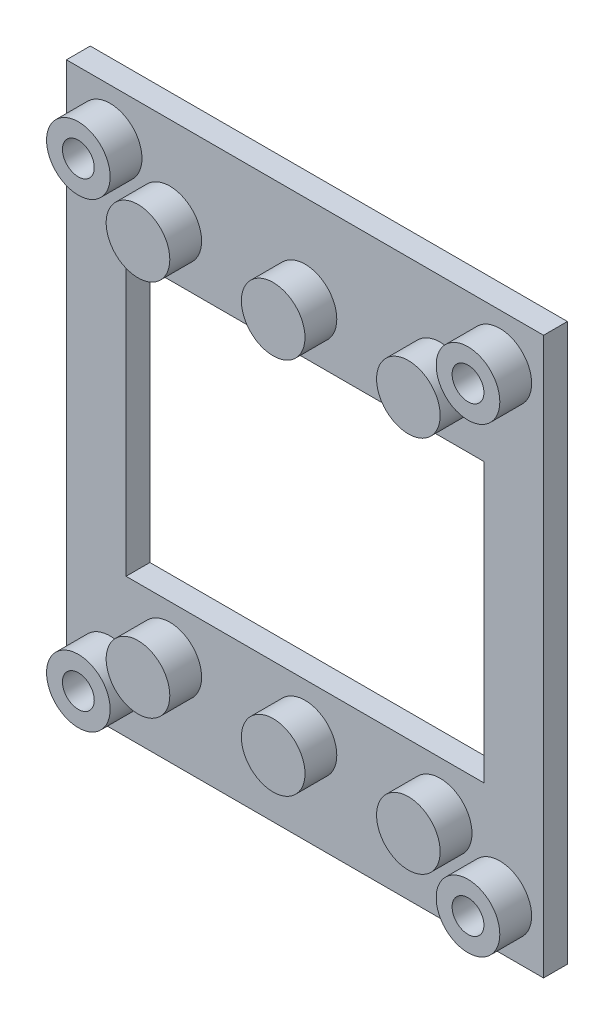
from build123d import *

# Parameters (mm, degrees)
ESQUISSE1_W               = 60
ESQUISSE1_H               = 70
T_LE_DE_BASE_PLI_E1_DEPTH = 3
ENL_V_MAT_EXTRU_1_REACH   = 48.195
ESQUISSE6_R               = 2
ENL_V_MAT_EXTRU_2_REACH   = 48.195
ESQUISSE7_R               = 2
BOSS_EXTRU_1_START        = 4
ESQUISSE9_R               = 4
ESQUISSE9_R_2             = 2
BOSS_EXTRU_1_DEPTH        = 4
ENL_V_MAT_EXTRU_3_REACH   = 48.271
ESQUISSE10_W              = 45
ESQUISSE10_H              = 35
BOSS_EXTRU_2_START        = -1
ESQUISSE11_R              = 2
BOSS_EXTRU_2_DEPTH        = 1
BOSS_EXTRU_3_START        = 3
ESQUISSE12_R              = 4
ESQUISSE12_R_2            = 2
BOSS_EXTRU_3_DEPTH        = 3
BOSS_EXTRU_4_START        = 1
ESQUISSE13_R              = 4
BOSS_EXTRU_4_DEPTH        = 1


# Sheet-metal steps are written as plain solids
with BuildPart() as part:
    # Esquisse1 → Tôle de base pliée1 (new body)
    with BuildSketch(Plane.XY):
        Rectangle(ESQUISSE1_W, ESQUISSE1_H)
    extrude(amount=-T_LE_DE_BASE_PLI_E1_DEPTH)

    # Esquisse6 → Enlèv. mat.-Extru.1 (cut, up to next)
    with BuildSketch(Plane.XY, mode=Mode.PRIVATE) as enl_v_mat_extru_1_sk1:
        with Locations((-24.5, 29)):
            Circle(ESQUISSE6_R)
    enl_v_mat_extru_1_tool1 = extrude(enl_v_mat_extru_1_sk1.sketch, amount=-ENL_V_MAT_EXTRU_1_REACH, mode=Mode.PRIVATE) & part.part
    # Esquisse6 → Enlèv. mat.-Extru.1 (cut, up to next)
    with BuildSketch(Plane.XY, mode=Mode.PRIVATE) as enl_v_mat_extru_1_sk2:
        with Locations((24.5, 29)):
            Circle(ESQUISSE6_R)
    enl_v_mat_extru_1_tool2 = extrude(enl_v_mat_extru_1_sk2.sketch, amount=-ENL_V_MAT_EXTRU_1_REACH, mode=Mode.PRIVATE) & part.part
    # Esquisse6 → Enlèv. mat.-Extru.1 (cut, up to next)
    with BuildSketch(Plane.XY, mode=Mode.PRIVATE) as enl_v_mat_extru_1_sk3:
        with Locations((24.5, -29)):
            Circle(ESQUISSE6_R)
    enl_v_mat_extru_1_tool3 = extrude(enl_v_mat_extru_1_sk3.sketch, amount=-ENL_V_MAT_EXTRU_1_REACH, mode=Mode.PRIVATE) & part.part
    # Esquisse6 → Enlèv. mat.-Extru.1 (cut, up to next)
    with BuildSketch(Plane.XY, mode=Mode.PRIVATE) as enl_v_mat_extru_1_sk4:
        with Locations((-24.5, -29)):
            Circle(ESQUISSE6_R)
    enl_v_mat_extru_1_tool4 = extrude(enl_v_mat_extru_1_sk4.sketch, amount=-ENL_V_MAT_EXTRU_1_REACH, mode=Mode.PRIVATE) & part.part
    add(enl_v_mat_extru_1_tool1.solids().sort_by_distance((-24.5, 29, 0))[0], mode=Mode.SUBTRACT)
    add(enl_v_mat_extru_1_tool2.solids().sort_by_distance((24.5, 29, 0))[0], mode=Mode.SUBTRACT)
    add(enl_v_mat_extru_1_tool3.solids().sort_by_distance((24.5, -29, 0))[0], mode=Mode.SUBTRACT)
    add(enl_v_mat_extru_1_tool4.solids().sort_by_distance((-24.5, -29, 0))[0], mode=Mode.SUBTRACT)

    # Esquisse7 → Enlèv. mat.-Extru.2 (cut, up to next)
    with BuildSketch(Plane.XY, mode=Mode.PRIVATE) as enl_v_mat_extru_2_sk1:
        with Locations((-17, -23.75)):
            Circle(ESQUISSE7_R)
    enl_v_mat_extru_2_tool1 = extrude(enl_v_mat_extru_2_sk1.sketch, amount=-ENL_V_MAT_EXTRU_2_REACH, mode=Mode.PRIVATE) & part.part
    # Esquisse7 → Enlèv. mat.-Extru.2 (cut, up to next)
    with BuildSketch(Plane.XY, mode=Mode.PRIVATE) as enl_v_mat_extru_2_sk2:
        with Locations((0, -23.75)):
            Circle(ESQUISSE7_R)
    enl_v_mat_extru_2_tool2 = extrude(enl_v_mat_extru_2_sk2.sketch, amount=-ENL_V_MAT_EXTRU_2_REACH, mode=Mode.PRIVATE) & part.part
    # Esquisse7 → Enlèv. mat.-Extru.2 (cut, up to next)
    with BuildSketch(Plane.XY, mode=Mode.PRIVATE) as enl_v_mat_extru_2_sk3:
        with Locations((17, -23.75)):
            Circle(ESQUISSE7_R)
    enl_v_mat_extru_2_tool3 = extrude(enl_v_mat_extru_2_sk3.sketch, amount=-ENL_V_MAT_EXTRU_2_REACH, mode=Mode.PRIVATE) & part.part
    # Esquisse7 → Enlèv. mat.-Extru.2 (cut, up to next)
    with BuildSketch(Plane.XY, mode=Mode.PRIVATE) as enl_v_mat_extru_2_sk4:
        with Locations((0, 23.75)):
            Circle(ESQUISSE7_R)
    enl_v_mat_extru_2_tool4 = extrude(enl_v_mat_extru_2_sk4.sketch, amount=-ENL_V_MAT_EXTRU_2_REACH, mode=Mode.PRIVATE) & part.part
    # Esquisse7 → Enlèv. mat.-Extru.2 (cut, up to next)
    with BuildSketch(Plane.XY, mode=Mode.PRIVATE) as enl_v_mat_extru_2_sk5:
        with Locations((17, 23.75)):
            Circle(ESQUISSE7_R)
    enl_v_mat_extru_2_tool5 = extrude(enl_v_mat_extru_2_sk5.sketch, amount=-ENL_V_MAT_EXTRU_2_REACH, mode=Mode.PRIVATE) & part.part
    # Esquisse7 → Enlèv. mat.-Extru.2 (cut, up to next)
    with BuildSketch(Plane.XY, mode=Mode.PRIVATE) as enl_v_mat_extru_2_sk6:
        with Locations((-17, 23.75)):
            Circle(ESQUISSE7_R)
    enl_v_mat_extru_2_tool6 = extrude(enl_v_mat_extru_2_sk6.sketch, amount=-ENL_V_MAT_EXTRU_2_REACH, mode=Mode.PRIVATE) & part.part
    add(enl_v_mat_extru_2_tool1.solids().sort_by_distance((-17, -23.75, 0))[0], mode=Mode.SUBTRACT)
    add(enl_v_mat_extru_2_tool2.solids().sort_by_distance((0, -23.75, 0))[0], mode=Mode.SUBTRACT)
    add(enl_v_mat_extru_2_tool3.solids().sort_by_distance((17, -23.75, 0))[0], mode=Mode.SUBTRACT)
    add(enl_v_mat_extru_2_tool4.solids().sort_by_distance((0, 23.75, 0))[0], mode=Mode.SUBTRACT)
    add(enl_v_mat_extru_2_tool5.solids().sort_by_distance((17, 23.75, 0))[0], mode=Mode.SUBTRACT)
    add(enl_v_mat_extru_2_tool6.solids().sort_by_distance((-17, 23.75, 0))[0], mode=Mode.SUBTRACT)

    # Esquisse9 → Boss.-Extru.1 (add)
    # profile 1 of 4: a face of its own
    with BuildSketch(Plane.XY.offset(BOSS_EXTRU_1_START)):
        with Locations((-24.5, 29)):
            Circle(ESQUISSE9_R)
        with Locations((-24.5, 29)):
            Circle(ESQUISSE9_R_2, mode=Mode.SUBTRACT)
    # profile 2 of 4: a face of its own
    with BuildSketch(Plane.XY.offset(BOSS_EXTRU_1_START)):
        with Locations((24.5, 29)):
            Circle(ESQUISSE9_R)
        with Locations((24.5, 29)):
            Circle(ESQUISSE9_R_2, mode=Mode.SUBTRACT)
    # profile 3 of 4: a face of its own
    with BuildSketch(Plane.XY.offset(BOSS_EXTRU_1_START)):
        with Locations((24.5, -29)):
            Circle(ESQUISSE9_R)
        with Locations((24.5, -29)):
            Circle(ESQUISSE9_R_2, mode=Mode.SUBTRACT)
    # profile 4 of 4: a face of its own
    with BuildSketch(Plane.XY.offset(BOSS_EXTRU_1_START)):
        with Locations((-24.5, -29)):
            Circle(ESQUISSE9_R)
        with Locations((-24.5, -29)):
            Circle(ESQUISSE9_R_2, mode=Mode.SUBTRACT)
    extrude(amount=-BOSS_EXTRU_1_DEPTH)

    # Esquisse10 → Enlèv. mat.-Extru.3 (cut, up to next)
    with BuildSketch(Plane.XY, mode=Mode.PRIVATE) as enl_v_mat_extru_3_sk1:
        Rectangle(ESQUISSE10_W, ESQUISSE10_H)
    enl_v_mat_extru_3_tool1 = extrude(enl_v_mat_extru_3_sk1.sketch, amount=-ENL_V_MAT_EXTRU_3_REACH, mode=Mode.PRIVATE) & part.part
    add(enl_v_mat_extru_3_tool1.solids().sort_by_distance((0, 0, 0))[0], mode=Mode.SUBTRACT)

    # Esquisse11 → Boss.-Extru.2 (add)
    with BuildSketch(Plane(origin=(0, 0, -3), x_dir=(-1, 0, 0), z_dir=(0, 0, -1)).offset(BOSS_EXTRU_2_START)):
        with Locations(Location((-24.5, -29, 0), (0, 0, 180))):
            Circle(ESQUISSE11_R)
        with Locations(Location((24.5, -29, 0), (0, 0, 180))):
            Circle(ESQUISSE11_R)
        with Locations(Location((24.5, 29, 0), (0, 0, 180))):
            Circle(ESQUISSE11_R)
        with Locations(Location((-24.5, 29, 0), (0, 0, 180))):
            Circle(ESQUISSE11_R)
    extrude(amount=BOSS_EXTRU_2_DEPTH)

    # Esquisse12 → Boss.-Extru.3 (add)
    # profile 1 of 6: a face of its own
    with BuildSketch(Plane.XY.offset(BOSS_EXTRU_3_START)):
        with Locations((-17, 23.75)):
            Circle(ESQUISSE12_R)
        with Locations((-17, 23.75)):
            Circle(ESQUISSE12_R_2, mode=Mode.SUBTRACT)
    # profile 2 of 6: a face of its own
    with BuildSketch(Plane.XY.offset(BOSS_EXTRU_3_START)):
        with Locations((0, 23.75)):
            Circle(ESQUISSE12_R)
        with Locations((0, 23.75)):
            Circle(ESQUISSE12_R_2, mode=Mode.SUBTRACT)
    # profile 3 of 6: a face of its own
    with BuildSketch(Plane.XY.offset(BOSS_EXTRU_3_START)):
        with Locations((17, 23.75)):
            Circle(ESQUISSE12_R)
        with Locations((17, 23.75)):
            Circle(ESQUISSE12_R_2, mode=Mode.SUBTRACT)
    # profile 4 of 6: a face of its own
    with BuildSketch(Plane.XY.offset(BOSS_EXTRU_3_START)):
        with Locations((17, -23.75)):
            Circle(ESQUISSE12_R)
        with Locations((17, -23.75)):
            Circle(ESQUISSE12_R_2, mode=Mode.SUBTRACT)
    # profile 5 of 6: a face of its own
    with BuildSketch(Plane.XY.offset(BOSS_EXTRU_3_START)):
        with Locations((0, -23.75)):
            Circle(ESQUISSE12_R)
        with Locations((0, -23.75)):
            Circle(ESQUISSE12_R_2, mode=Mode.SUBTRACT)
    # profile 6 of 6: a face of its own
    with BuildSketch(Plane.XY.offset(BOSS_EXTRU_3_START)):
        with Locations((-17, -23.75)):
            Circle(ESQUISSE12_R)
        with Locations((-17, -23.75)):
            Circle(ESQUISSE12_R_2, mode=Mode.SUBTRACT)
    extrude(amount=-BOSS_EXTRU_3_DEPTH)

    # Esquisse13 → Boss.-Extru.4 (add)
    with BuildSketch(Plane.XY.offset(3).offset(BOSS_EXTRU_4_START)):
        with Locations((-17, -23.75)):
            Circle(ESQUISSE13_R)
        with Locations((0, -23.75)):
            Circle(ESQUISSE13_R)
        with Locations((17, -23.75)):
            Circle(ESQUISSE13_R)
        with Locations((17, 23.75)):
            Circle(ESQUISSE13_R)
        with Locations((0, 23.75)):
            Circle(ESQUISSE13_R)
        with Locations((-17, 23.75)):
            Circle(ESQUISSE13_R)
    extrude(amount=-BOSS_EXTRU_4_DEPTH)


solid = part.part
